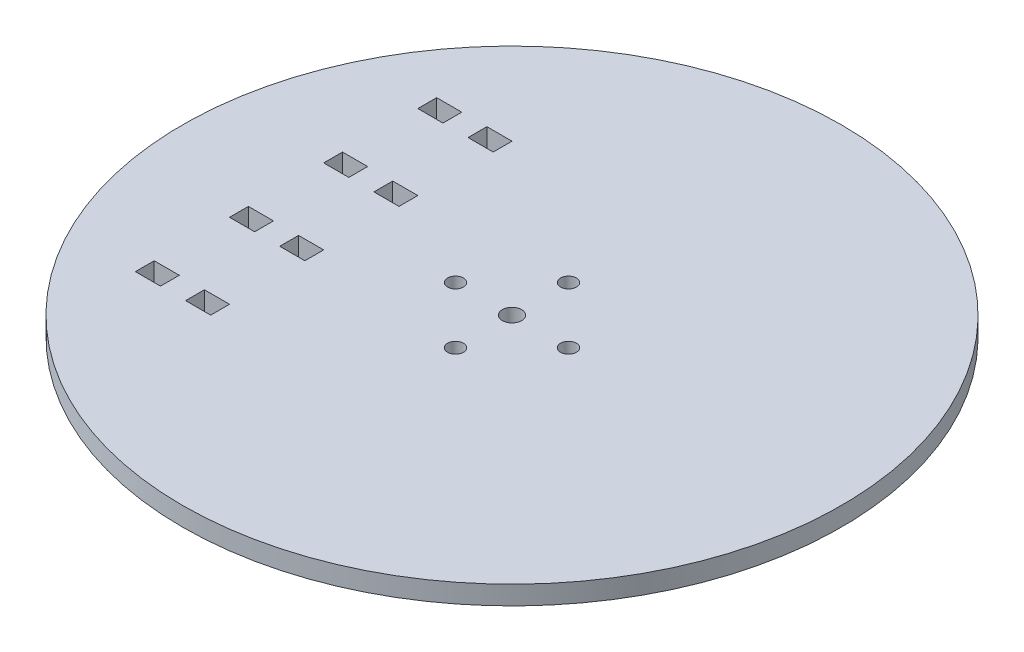
from build123d import *

# Parameters (mm, degrees)
SKETCH1_R                 = 87.5
BOSS_EXTRUDE1_DEPTH       = 5
SKETCH2_W                 = 6.666666667
SKETCH2_H                 = 5
CUT_EXTRUDE1_DEPTH        = 124.844660765
LPATTERN1_COUNT           = 2
LPATTERN1_PITCH           = 25
LPATTERN2_COPY_1_SKETCH_W = 6.666666667
LPATTERN2_COPY_1_SKETCH_H = 5
LPATTERN2_COPY_1_DEPTH    = 124.844660765
LPATTERN2_COPY_2_SKETCH_W = 6.666666667
LPATTERN2_COPY_2_SKETCH_H = 5
LPATTERN2_COPY_2_DEPTH    = 124.844660765
SKETCH3_R                 = 2.1
CUT_EXTRUDE2_DEPTH        = 124.844660765
CIRPATTERN1_COUNT         = 4
SKETCH4_R                 = 2.55
CUT_EXTRUDE3_DEPTH        = 10


with BuildPart() as part:
    # Sketch1 → Boss-Extrude1 (new body)
    with BuildSketch(Plane(origin=(0, 0, 0), x_dir=(1, 0, 0), z_dir=(0, 1, 0))):
        Circle(SKETCH1_R)
    extrude(amount=BOSS_EXTRUDE1_DEPTH)

    # Sketch2 → Cut-Extrude1 (cut, through all)
    with BuildSketch(Plane(origin=(0, 5, 0), x_dir=(1, 0, 0), z_dir=(0, 1, 0))):
        with Locations((-56.666666667, 12.5)):
            Rectangle(SKETCH2_W, SKETCH2_H)
        with Locations((-43.333333334, 12.5)):
            Rectangle(SKETCH2_W, SKETCH2_H)
    cut_extrude1 = extrude(amount=-CUT_EXTRUDE1_DEPTH, mode=Mode.SUBTRACT)

    # Mirror1: Cut-Extrude1 across plane
    add(cut_extrude1.mirror(Plane.XY), mode=Mode.SUBTRACT)

    # LPattern1: Cut-Extrude1 ×2
    with Locations(*[(0, 0, -i * LPATTERN1_PITCH) for i in range(1, LPATTERN1_COUNT)]):
        add(cut_extrude1, mode=Mode.SUBTRACT)

    # LPattern2 copy 1 sketch → LPattern2 copy 1 (cut, through all)
    with BuildSketch(Plane(origin=(0, 5, 25), x_dir=(1, 0, 0), z_dir=(0, 1, 0))):
        with Locations((-56.666666667, -12.5)):
            Rectangle(LPATTERN2_COPY_1_SKETCH_W, LPATTERN2_COPY_1_SKETCH_H)
        with Locations((-43.333333334, -12.5)):
            Rectangle(LPATTERN2_COPY_1_SKETCH_W, LPATTERN2_COPY_1_SKETCH_H)
    extrude(amount=-LPATTERN2_COPY_1_DEPTH, mode=Mode.SUBTRACT)

    # LPattern2 copy 2 sketch → LPattern2 copy 2 (cut, through all)
    with BuildSketch(Plane(origin=(0, 5, 25), x_dir=(1, 0, 0), z_dir=(0, 1, 0))):
        with Locations((-56.666666667, 12.5)):
            Rectangle(LPATTERN2_COPY_2_SKETCH_W, LPATTERN2_COPY_2_SKETCH_H)
        with Locations((-43.333333334, 12.5)):
            Rectangle(LPATTERN2_COPY_2_SKETCH_W, LPATTERN2_COPY_2_SKETCH_H)
    extrude(amount=-LPATTERN2_COPY_2_DEPTH, mode=Mode.SUBTRACT)

    # Sketch3 → Cut-Extrude2 (cut, through all)
    with BuildSketch(Plane(origin=(0, 5, 0), x_dir=(1, 0, 0), z_dir=(0, 1, 0))):
        with Locations((0, 15)):
            Circle(SKETCH3_R)
    cut_extrude2 = extrude(amount=-CUT_EXTRUDE2_DEPTH, mode=Mode.SUBTRACT)

    # CirPattern1: Cut-Extrude2 ×4 about axis
    cirpattern1_axis = Axis((0, 5, 0), (0, -1, 0))
    for i in range(1, CIRPATTERN1_COUNT):
        add(cut_extrude2.rotate(cirpattern1_axis, i * 360 / CIRPATTERN1_COUNT), mode=Mode.SUBTRACT)

    # Sketch4 → Cut-Extrude3 (cut)
    with BuildSketch(Plane(origin=(0, 5, 0), x_dir=(1, 0, 0), z_dir=(0, 1, 0))):
        Circle(SKETCH4_R)
    extrude(amount=-CUT_EXTRUDE3_DEPTH, mode=Mode.SUBTRACT)


solid = part.part
